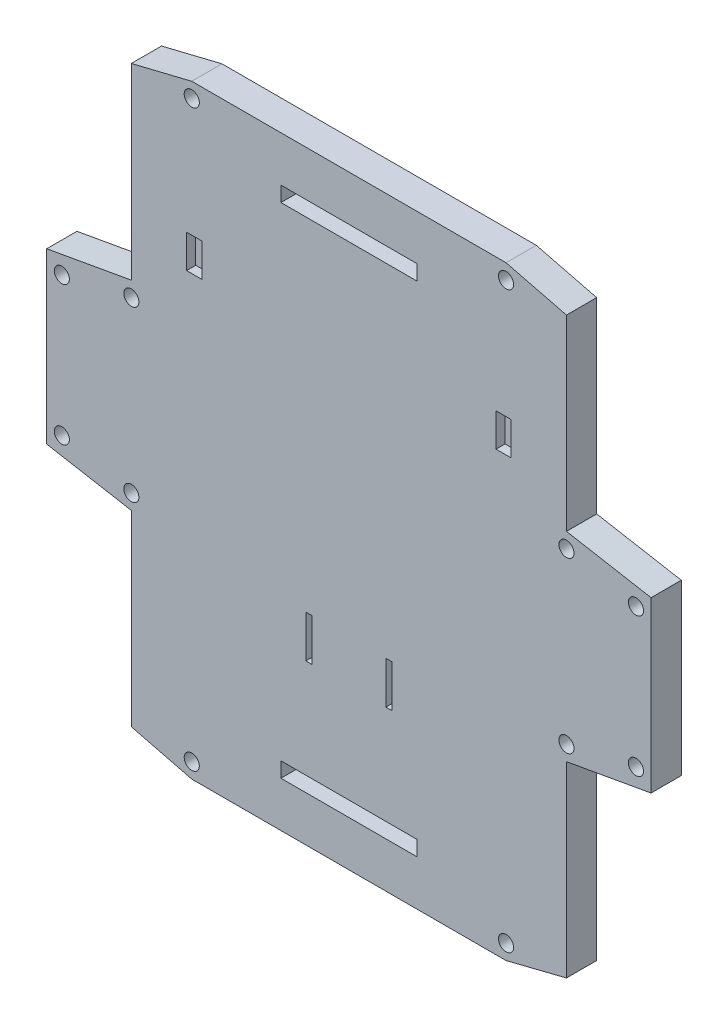
from build123d import *

# Parameters (mm, degrees)
BOSS_EXTRUDE2_DEPTH  = 15
SKETCH2_W            = 3
SKETCH2_H            = 20
CUT_EXTRUDE2_DEPTH   = 10
SKETCH4_W            = 3
SKETCH4_H            = 20
BOSS_EXTRUDE5_DEPTH  = 10
CUT_EXTRUDE3_DEPTH   = 5
SKETCH6_R            = 2.5
CUT_EXTRUDE4_DEPTH   = 6
SKETCH7_R            = 2.5
BOSS_EXTRUDE6_DEPTH  = 6
SKETCH8_R            = 2.5
CUT_EXTRUDE5_DEPTH   = 6
SKETCH9_W            = 2
SKETCH9_H            = 14
CUT_EXTRUDE6_DEPTH   = 3
SKETCH10_W           = 5
SKETCH10_H           = 11
CUT_EXTRUDE7_DEPTH   = 3
BOSS_EXTRUDE8_DEPTH  = 3
SKETCH12_W           = 5
SKETCH12_H           = 2
CUT_EXTRUDE8_DEPTH   = 3
SKETCH14_W           = 5
SKETCH14_H           = 7.25
BOSS_EXTRUDE9_DEPTH  = 3
SKETCH15_W           = 5
SKETCH15_H           = 7.25
CUT_EXTRUDE9_DEPTH   = 3
SKETCH16_W           = 5
SKETCH16_H           = 7.25
BOSS_EXTRUDE10_DEPTH = 3
SKETCH17_W           = 5
SKETCH17_H           = 7.25
CUT_EXTRUDE10_DEPTH  = 3
SKETCH18_W           = 5
SKETCH18_H           = 7.25
BOSS_EXTRUDE11_DEPTH = 3
SKETCH19_W           = 5
SKETCH19_H           = 7.25
CUT_EXTRUDE11_DEPTH  = 3
SKETCH20_W           = 5
SKETCH20_H           = 7.25
BOSS_EXTRUDE12_DEPTH = 3
SKETCH21_W           = 5
SKETCH21_H           = 7.25
CUT_EXTRUDE12_DEPTH  = 3
SKETCH22_W           = 2
SKETCH22_H           = 7.25
CUT_EXTRUDE13_DEPTH  = 3
SKETCH23_W           = 2
SKETCH23_H           = 7.25
BOSS_EXTRUDE13_DEPTH = 3
SKETCH24_W           = 45
SKETCH24_H           = 5
CUT_EXTRUDE14_DEPTH  = 5
SKETCH25_W           = 45
SKETCH25_H           = 5
BOSS_EXTRUDE17_DEPTH = 5
SKETCH26_W           = 45
SKETCH26_H           = 5
CUT_EXTRUDE16_DEPTH  = 5


with BuildPart() as part:
    # Sketch1 → Boss-Extrude2 (new body)
    with BuildSketch(Plane.XY):
        Polygon((-52, 100), (52, 100), (72, 95), (72, 33), (100, 28), (100, -28), (72, -33), (72, -95), (52, -100), (-52, -100), (-72, -95), (-72, -33), (-100, -28), (-100, 28), (-72, 33), (-72, 95.107401563), align=None)
    extrude(amount=BOSS_EXTRUDE2_DEPTH)

    # Sketch2 → Cut-Extrude2 (cut)
    with BuildSketch(Plane.XY.offset(15)):
        with Locations((-69.5, 80.352031484)):
            Rectangle(SKETCH2_W, SKETCH2_H)
        with Locations((-69.5, 43)):
            Rectangle(SKETCH2_W, SKETCH2_H)
    extrude(amount=-CUT_EXTRUDE2_DEPTH, mode=Mode.SUBTRACT)

    # Sketch4 → Boss-Extrude5 (add)
    with BuildSketch(Plane.XY.offset(15)):
        Polygon((-71, 90.352031484), (-68, 90.352031484), (-68, 70.352031484), (-69.5, 70.352031484), (-71, 70.352031484), align=None)
        with Locations((-69.5, 43)):
            Rectangle(SKETCH4_W, SKETCH4_H)
    extrude(amount=-BOSS_EXTRUDE5_DEPTH)

    # Sketch5 → Cut-Extrude3 (cut)
    with BuildSketch(Plane.XY.offset(15)):
        Polygon((-72, 95.107401563), (-72, 33), (-100, 28), (-100, -28), (-72, -33), (-72, -95), (-52, -100), (52, -100), (72, -95), (72, -33), (100, -28), (100, 28), (72, 33), (72, 95), (52, 100), (-52, 100), align=None)
    extrude(amount=-CUT_EXTRUDE3_DEPTH, mode=Mode.SUBTRACT)

    # Sketch6 → Cut-Extrude4 (cut)
    with BuildSketch(Plane.XY.offset(10)):
        with Locations((-95, -23)):
            Circle(SKETCH6_R)
        with Locations((-72, 28)):
            Circle(SKETCH6_R)
        with Locations((-72, -28)):
            Circle(SKETCH6_R)
        with Locations((-52, -95)):
            Circle(SKETCH6_R)
        with Locations((52, -95)):
            Circle(SKETCH6_R)
        with Locations((67, -28)):
            Circle(SKETCH6_R)
        with Locations((72, 28)):
            Circle(SKETCH6_R)
        with Locations((95, 23)):
            Circle(SKETCH6_R)
        with Locations((-52, 95.092484679)):
            Circle(SKETCH6_R)
        with Locations((52, 95.014916884)):
            Circle(SKETCH6_R)
        with Locations((95, -23)):
            Circle(SKETCH6_R)
        with Locations((-95, 23)):
            Circle(SKETCH6_R)
    extrude(amount=-CUT_EXTRUDE4_DEPTH, mode=Mode.SUBTRACT)

    # Sketch7 → Boss-Extrude6 (add)
    with BuildSketch(Plane.XY.offset(10)):
        with Locations((67, -28)):
            Circle(SKETCH7_R)
    extrude(amount=-BOSS_EXTRUDE6_DEPTH)

    # Sketch8 → Cut-Extrude5 (cut)
    with BuildSketch(Plane.XY.offset(10)):
        with Locations((-72, -28)):
            Circle(SKETCH8_R)
        with Locations((72, -28)):
            Circle(SKETCH8_R)
    extrude(amount=-CUT_EXTRUDE5_DEPTH, mode=Mode.SUBTRACT)

    # Sketch9 → Cut-Extrude6 (cut)
    with BuildSketch(Plane.XY.offset(10)):
        with Locations((-13.25, -33)):
            Rectangle(SKETCH9_W, SKETCH9_H)
        with Locations((13.25, -33)):
            Rectangle(SKETCH9_W, SKETCH9_H)
    extrude(amount=-CUT_EXTRUDE6_DEPTH, mode=Mode.SUBTRACT)

    # Sketch10 → Cut-Extrude7 (cut)
    with BuildSketch(Plane.XY.offset(10)):
        with Locations((-51.19, 52.4)):
            Rectangle(SKETCH10_W, SKETCH10_H)
        with Locations((51.19, 52.4)):
            Rectangle(SKETCH10_W, SKETCH10_H)
    extrude(amount=-CUT_EXTRUDE7_DEPTH, mode=Mode.SUBTRACT)

    # Sketch11 → Boss-Extrude8 (add)
    with BuildSketch(Plane.XY.offset(10)):
        Polygon((-53.69, 55.9), (-48.69, 55.9), (-48.69, 57.549860814), (-48.69, 57.9), (-53.69, 57.9), align=None)
        Polygon((53.69, 57.9), (48.69, 57.9), (48.69, 55.9), (53.69, 55.9), (53.69, 57.549860814), align=None)
    extrude(amount=-BOSS_EXTRUDE8_DEPTH)

    # Sketch12 → Cut-Extrude8 (cut)
    with BuildSketch(Plane.XY.offset(10)):
        with Locations((-51.19, 45.9)):
            Rectangle(SKETCH12_W, SKETCH12_H)
        Polygon((53.69, 46.9), (48.69, 46.9), (48.69, 44.9), (53.69, 44.9), (53.69, 45.878343836), align=None)
    extrude(amount=-CUT_EXTRUDE8_DEPTH, mode=Mode.SUBTRACT)

    # Sketch14 → Boss-Extrude9 (add)
    with BuildSketch(Plane.XY.offset(10)):
        with Locations((-51.19, 48.525)):
            Rectangle(SKETCH14_W, SKETCH14_H)
    extrude(amount=-BOSS_EXTRUDE9_DEPTH)

    # Sketch15 → Cut-Extrude9 (cut)
    with BuildSketch(Plane.XY.offset(10)):
        with Locations((-51.19, 59.525)):
            Rectangle(SKETCH15_W, SKETCH15_H)
    extrude(amount=-CUT_EXTRUDE9_DEPTH, mode=Mode.SUBTRACT)

    # Sketch16 → Boss-Extrude10 (add)
    with BuildSketch(Plane.XY.offset(10)):
        with Locations((51.19, 48.525)):
            Rectangle(SKETCH16_W, SKETCH16_H)
    extrude(amount=-BOSS_EXTRUDE10_DEPTH)

    # Sketch17 → Cut-Extrude10 (cut)
    with BuildSketch(Plane.XY.offset(10)):
        with Locations((51.19, 59.525)):
            Rectangle(SKETCH17_W, SKETCH17_H)
    extrude(amount=-CUT_EXTRUDE10_DEPTH, mode=Mode.SUBTRACT)

    # Sketch18 → Boss-Extrude11 (add)
    with BuildSketch(Plane.XY.offset(10)):
        with Locations((-51.19, 59.525)):
            Rectangle(SKETCH18_W, SKETCH18_H)
    extrude(amount=-BOSS_EXTRUDE11_DEPTH)

    # Sketch19 → Cut-Extrude11 (cut)
    with BuildSketch(Plane.XY.offset(10)):
        with Locations((-51.19, 48.525)):
            Rectangle(SKETCH19_W, SKETCH19_H)
    extrude(amount=-CUT_EXTRUDE11_DEPTH, mode=Mode.SUBTRACT)

    # Sketch20 → Boss-Extrude12 (add)
    with BuildSketch(Plane.XY.offset(10)):
        with Locations((51.19, 59.525)):
            Rectangle(SKETCH20_W, SKETCH20_H)
    extrude(amount=-BOSS_EXTRUDE12_DEPTH)

    # Sketch21 → Cut-Extrude12 (cut)
    with BuildSketch(Plane.XY.offset(10)):
        with Locations((51.19, 48.525)):
            Rectangle(SKETCH21_W, SKETCH21_H)
    extrude(amount=-CUT_EXTRUDE12_DEPTH, mode=Mode.SUBTRACT)

    # Sketch22 → Cut-Extrude13 (cut)
    with BuildSketch(Plane.XY.offset(10)):
        with Locations((-13.25, -43.625)):
            Rectangle(SKETCH22_W, SKETCH22_H)
        with Locations((13.25, -43.625)):
            Rectangle(SKETCH22_W, SKETCH22_H)
    extrude(amount=-CUT_EXTRUDE13_DEPTH, mode=Mode.SUBTRACT)

    # Sketch23 → Boss-Extrude13 (add)
    with BuildSketch(Plane.XY.offset(10)):
        with Locations((-13.25, -29.625)):
            Rectangle(SKETCH23_W, SKETCH23_H)
        with Locations((13.25, -29.625)):
            Rectangle(SKETCH23_W, SKETCH23_H)
    extrude(amount=-BOSS_EXTRUDE13_DEPTH)

    # Sketch24 → Cut-Extrude14 (cut)
    with BuildSketch(Plane.XY.offset(10)):
        with Locations((0, 95.053700781)):
            Rectangle(SKETCH24_W, SKETCH24_H)
        with Locations((0, -95)):
            Rectangle(SKETCH24_W, SKETCH24_H)
    extrude(amount=-CUT_EXTRUDE14_DEPTH, mode=Mode.SUBTRACT)

    # Sketch25 → Boss-Extrude17 (add)
    with BuildSketch(Plane.XY.offset(5)):
        with Locations((0, 95.053700781)):
            Rectangle(SKETCH25_W, SKETCH25_H)
        with Locations((0, -95)):
            Rectangle(SKETCH25_W, SKETCH25_H)
    extrude(amount=BOSS_EXTRUDE17_DEPTH)

    # Sketch26 → Cut-Extrude16 (cut)
    with BuildSketch(Plane.XY.offset(10)):
        with Locations((0, -82.5)):
            Rectangle(SKETCH26_W, SKETCH26_H)
        with Locations((0, 82.5)):
            Rectangle(SKETCH26_W, SKETCH26_H)
    extrude(amount=-CUT_EXTRUDE16_DEPTH, mode=Mode.SUBTRACT)


solid = part.part
